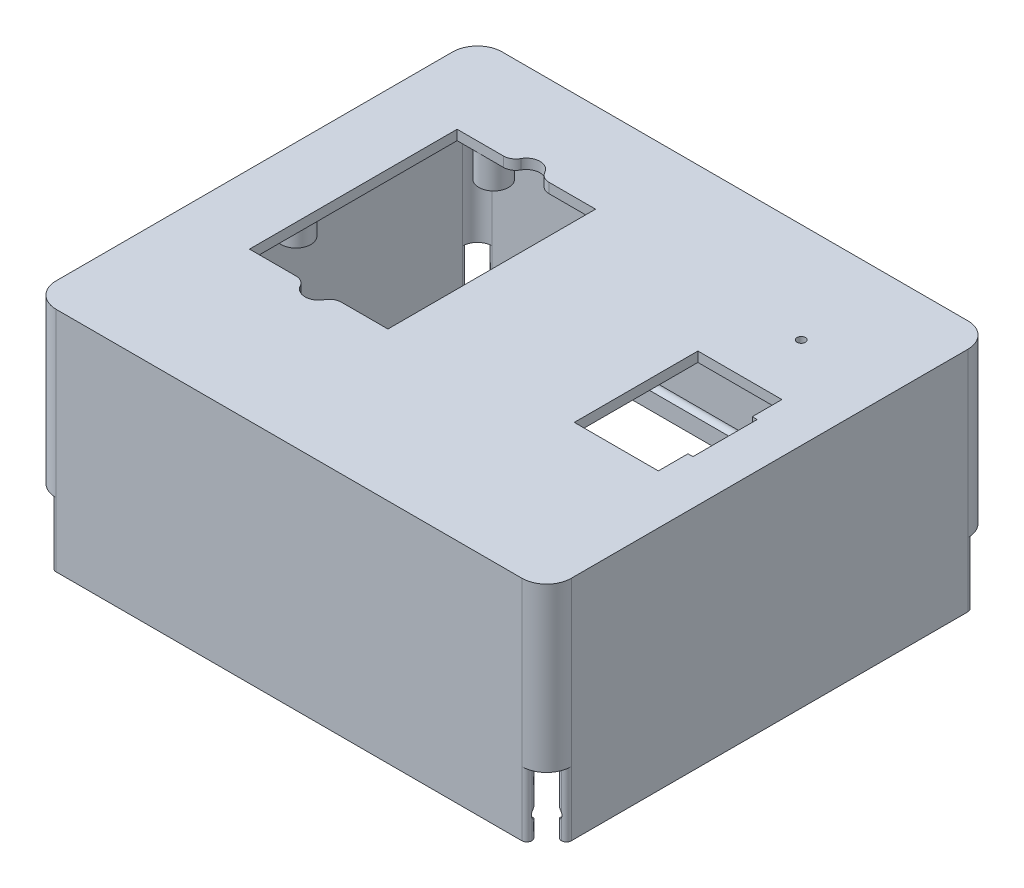
from build123d import *

# Parameters (mm, degrees)
ESQUISSE1_W                   = 104.2
ESQUISSE1_H                   = 90.2
BOSS_EXTRU_1_DEPTH            = 2
ESQUISSE2_W                   = 104.2
ESQUISSE2_H                   = 90.2
ESQUISSE2_W_2                 = 100.2
ESQUISSE2_H_2                 = 86.2
BOSS_EXTRU_2_DEPTH            = 44
ENL_V_MAT_EXTRU_1_DEPTH       = 13
SYM_TRIE2_COPY_1_DEPTH        = 13
CONG_3_R                      = 1
CONG_1_R                      = 5
ENL_V_MAT_EXTRU_2_DEPTH       = 82.758302331
ENL_V_MAT_EXTRU_3_DEPTH       = 82.758302438
ESQUISSE15_W                  = 100.6
ESQUISSE15_H                  = 86.6
ENL_V_MAT_EXTRU_10_DEPTH      = 4.5
ENL_V_MAT_EXTRU_12_REACH      = 83.758
ESQUISSE17_W                  = 28
ESQUISSE17_H                  = 42
ESQUISSE19_R                  = 3
BOSS_EXTRU_5_DEPTH            = 6.2
ESQUISSE20_R                  = 0.85
ENL_V_MAT_EXTRU_13_DEPTH      = 5.8
ENL_V_MAT_EXTRU_16_REACH      = 84.852
ESQUISSE23_W                  = 17
ESQUISSE23_H                  = 25
ENL_V_MAT_EXTRU_17_REACH      = 83.758
ESQUISSE24_R                  = 0.85
ENL_V_MAT_EXTRU_18_REACH      = 84.852
ESQUISSE25_W                  = 1
ESQUISSE25_H                  = 13
ESQUISSE26_W                  = 1.8
ESQUISSE26_H                  = 5.5
ESQUISSE26_W_2                = 24
ESQUISSE26_H_2                = 2
ESQUISSE26_W_3                = 1
BOSS_EXTRU_6_DEPTH            = 2.1
ESQUISSE27_W                  = 5.5
ESQUISSE27_H                  = 7.5
BOSS_EXTRU_7_DEPTH            = 1.5
ENL_V_MAT_EXTRU_20_DEPTH      = 82.758302501
ENL_V_MAT_EXTRU_20_DEPTH_BACK = 82.758302501
ESQUISSE29_R                  = 2.75
CONG_4_R                      = 2.5
CONG_5_R                      = 3


with BuildPart() as part:
    # Esquisse1 → Boss.-Extru.1 (new body)
    with BuildSketch(Plane(origin=(0, 0, 0), x_dir=(1, 0, 0), z_dir=(0, 1, 0))):
        Rectangle(ESQUISSE1_W, ESQUISSE1_H)
    extrude(amount=BOSS_EXTRU_1_DEPTH)

    # Esquisse2 → Boss.-Extru.2 (add)
    with BuildSketch(Plane.XZ):
        Rectangle(ESQUISSE2_W, ESQUISSE2_H)
        Rectangle(ESQUISSE2_W_2, ESQUISSE2_H_2, mode=Mode.SUBTRACT)
    extrude(amount=BOSS_EXTRU_2_DEPTH)

    # Esquisse3 → Enlèv. mat.-Extru.1 (cut)
    with BuildSketch(Plane.XZ.offset(44)):
        Polygon((-50.1, 41.1), (-50.1, 43.1), (-48.1, 43.1), (-48.1, 45.1), (-52.1, 45.1), (-52.1, 41.1), align=None)
    enl_v_mat_extru_1 = extrude(amount=-ENL_V_MAT_EXTRU_1_DEPTH, mode=Mode.SUBTRACT)

    # Symétrie1: Enlèv. mat.-Extru.1 across plane
    add(enl_v_mat_extru_1.mirror(Plane.XY), mode=Mode.SUBTRACT)

    # Symétrie2: Enlèv. mat.-Extru.1 across plane
    add(enl_v_mat_extru_1.mirror(Plane(origin=(0, 0, 0), x_dir=(0, 0, 1), z_dir=(1, 0, 0))), mode=Mode.SUBTRACT)

    # Symétrie2 copy 1 sketch → Symétrie2 copy 1 (cut)
    with BuildSketch(Plane(origin=(0, -44, 0), x_dir=(-1, 0, 0), z_dir=(0, -1, 0))):
        Polygon((-50.1, 41.1), (-50.1, 43.1), (-48.1, 43.1), (-48.1, 45.1), (-52.1, 45.1), (-52.1, 41.1), align=None)
    extrude(amount=-SYM_TRIE2_COPY_1_DEPTH, mode=Mode.SUBTRACT)

    # Congé3
    cong_3_edges = [part.edges().sort_by_distance(p)[0] for p in [
        (-48.1, -37.5, 45.1),
        (-48.1, -37.5, 43.1),
        (-50.1, -37.5, 41.1),
        (-52.1, -37.5, 41.1),
        (48.1, -37.5, 45.1),
        (48.1, -37.5, 43.1),
        (52.1, -37.5, 41.1),
        (50.1, -37.5, 41.1),
        (52.1, -37.5, -41.1),
        (50.1, -37.5, -41.1),
        (48.1, -37.5, -43.1),
        (48.1, -37.5, -45.1),
        (-48.1, -37.5, -45.1),
        (-48.1, -37.5, -43.1),
        (-50.1, -37.5, -41.1),
        (-52.1, -37.5, -41.1),
    ]]
    fillet(cong_3_edges, radius=CONG_3_R - 0.0001)  # a hair under: the kernel refuses the full size

    # Congé1
    cong_1_edges = [part.edges().sort_by_distance(p)[0] for p in [
        (52.1, -14.5, 45.1),
        (52.1, -14.5, -45.1),
        (-52.1, -14.5, -45.1),
        (-52.1, -14.5, 45.1),
    ]]
    fillet(cong_1_edges, radius=CONG_1_R)

    # Esquisse4 → Enlèv. mat.-Extru.2 (cut, symmetric)
    with BuildSketch(Plane(origin=(0, 0, 0), x_dir=(0, 0, -1), z_dir=(1, 0, 0))):
        with BuildLine():
            Line((-43.1, -38.4), (-43.1, -40.6))
            ThreePointArc((-43.1, -40.6), (-44.2, -39.5), (-43.1, -38.4))
        make_face()
    enl_v_mat_extru_2 = extrude(amount=ENL_V_MAT_EXTRU_2_DEPTH, both=True, mode=Mode.SUBTRACT)

    # Symétrie4: Enlèv. mat.-Extru.2 across plane
    add(enl_v_mat_extru_2.mirror(Plane.XY), mode=Mode.SUBTRACT)

    # Esquisse5 → Enlèv. mat.-Extru.3 (cut, symmetric)
    with BuildSketch(Plane.XY):
        with BuildLine():
            Line((-50.1, -38.4), (-50.1, -40.6))
            ThreePointArc((-50.1, -40.6), (-51.2, -39.5), (-50.1, -38.4))
        make_face()
    enl_v_mat_extru_3 = extrude(amount=ENL_V_MAT_EXTRU_3_DEPTH, both=True, mode=Mode.SUBTRACT)

    # Symétrie5: Enlèv. mat.-Extru.3 across plane
    add(enl_v_mat_extru_3.mirror(Plane(origin=(0, 0, 0), x_dir=(0, 0, 1), z_dir=(1, 0, 0))), mode=Mode.SUBTRACT)

    # Esquisse15 → Enlèv. mat.-Extru.10 (cut)
    with BuildSketch(Plane.XZ.offset(44)):
        Rectangle(ESQUISSE15_W, ESQUISSE15_H)
    extrude(amount=-ENL_V_MAT_EXTRU_10_DEPTH, mode=Mode.SUBTRACT)

    # Esquisse17 → Enlèv. mat.-Extru.12 (cut, up to next)
    with BuildSketch(Plane.XZ, mode=Mode.PRIVATE) as enl_v_mat_extru_12_sk1:
        with Locations((-24.1, -6)):
            Rectangle(ESQUISSE17_W, ESQUISSE17_H)
    enl_v_mat_extru_12_tool1 = extrude(enl_v_mat_extru_12_sk1.sketch, amount=-ENL_V_MAT_EXTRU_12_REACH, mode=Mode.PRIVATE) & part.part
    add(enl_v_mat_extru_12_tool1.solids().sort_by_distance((-24.1, 0, -6))[0], mode=Mode.SUBTRACT)

    # Esquisse19 → Boss.-Extru.5 (add)
    with BuildSketch(Plane.XZ):
        with Locations(Location((-33.9, 29.8, 0), (0, 0, 90))):
            Circle(ESQUISSE19_R)
        with Locations(Location((-33.9, -30.2, 0), (0, 0, 90))):
            Circle(ESQUISSE19_R)
        with Locations(Location((-3.9, 19.8, 0), (0, 0, 90))):
            Circle(ESQUISSE19_R)
        with Locations(Location((-3.9, -20.2, 0), (0, 0, 90))):
            Circle(ESQUISSE19_R)
        with Locations(Location((-43.9, -0.2, 0), (0, 0, 90))):
            Circle(ESQUISSE19_R)
    extrude(amount=BOSS_EXTRU_5_DEPTH)

    # Esquisse20 → Enlèv. mat.-Extru.13 (cut)
    with BuildSketch(Plane.XZ.offset(6.2)):
        with Locations(Location((-33.9, 29.8, 0), (0, 0, 270))):
            Circle(ESQUISSE20_R)
        with Locations(Location((-3.9, 19.8, 0), (0, 0, 270))):
            Circle(ESQUISSE20_R)
        with Locations(Location((-3.9, -20.2, 0), (0, 0, 270))):
            Circle(ESQUISSE20_R)
        with Locations(Location((-33.9, -30.2, 0), (0, 0, 270))):
            Circle(ESQUISSE20_R)
        with Locations(Location((-43.9, -0.2, 0), (0, 0, 270))):
            Circle(ESQUISSE20_R)
    extrude(amount=-ENL_V_MAT_EXTRU_13_DEPTH, mode=Mode.SUBTRACT)

    # Esquisse23 → Enlèv. mat.-Extru.16 (cut, up to next)
    with BuildSketch(Plane(origin=(0, 2, 0), x_dir=(1, 0, 0), z_dir=(0, 1, 0)), mode=Mode.PRIVATE) as enl_v_mat_extru_16_sk1:
        with Locations((33.6, 0)):
            Rectangle(ESQUISSE23_W, ESQUISSE23_H)
    enl_v_mat_extru_16_tool1 = extrude(enl_v_mat_extru_16_sk1.sketch, amount=-ENL_V_MAT_EXTRU_16_REACH, mode=Mode.PRIVATE) & part.part
    add(enl_v_mat_extru_16_tool1.solids().sort_by_distance((33.6, 2, 0))[0], mode=Mode.SUBTRACT)

    # Esquisse24 → Enlèv. mat.-Extru.17 (cut, up to next)
    with BuildSketch(Plane.XZ, mode=Mode.PRIVATE) as enl_v_mat_extru_17_sk1:
        with Locations(Location((33.6, -24.9, 0), (0, 0, 270))):
            Circle(ESQUISSE24_R)
    enl_v_mat_extru_17_tool1 = extrude(enl_v_mat_extru_17_sk1.sketch, amount=-ENL_V_MAT_EXTRU_17_REACH, mode=Mode.PRIVATE) & part.part
    add(enl_v_mat_extru_17_tool1.solids().sort_by_distance((33.6, 0, -24.9))[0], mode=Mode.SUBTRACT)

    # Esquisse25 → Enlèv. mat.-Extru.18 (cut, up to next)
    with BuildSketch(Plane(origin=(0, 2, 0), x_dir=(1, 0, 0), z_dir=(0, 1, 0)), mode=Mode.PRIVATE) as enl_v_mat_extru_18_sk1:
        with Locations((42.6, 0)):
            Rectangle(ESQUISSE25_W, ESQUISSE25_H)
    enl_v_mat_extru_18_tool1 = extrude(enl_v_mat_extru_18_sk1.sketch, amount=-ENL_V_MAT_EXTRU_18_REACH, mode=Mode.PRIVATE) & part.part
    add(enl_v_mat_extru_18_tool1.solids().sort_by_distance((42.6, 2, 0))[0], mode=Mode.SUBTRACT)

    # Esquisse26 → Boss.-Extru.6 (add)
    with BuildSketch(Plane.XZ):
        with Locations((22.5, 13.25)):
            Rectangle(ESQUISSE26_W, ESQUISSE26_H)
        with Locations((33.6, 17)):
            Rectangle(ESQUISSE26_W_2, ESQUISSE26_H_2)
        with Locations((45.1, 13.25)):
            Rectangle(ESQUISSE26_W_3, ESQUISSE26_H)
    extrude(amount=BOSS_EXTRU_6_DEPTH)

    # Esquisse27 → Boss.-Extru.7 (add)
    with BuildSketch(Plane.XZ.offset(2.1)):
        with Locations((24.35, 14.25)):
            Rectangle(ESQUISSE27_W, ESQUISSE27_H)
        with Locations((42.85, 14.25)):
            Rectangle(ESQUISSE27_W, ESQUISSE27_H)
    extrude(amount=BOSS_EXTRU_7_DEPTH)

    # Esquisse29 → Enlèv. mat.-Extru.20 (cut, two sides: drawn at the far end of the back side and taken through both)
    with BuildSketch(Plane.XZ.offset(-ENL_V_MAT_EXTRU_20_DEPTH_BACK)):
        with Locations((-24.1, 15)):
            Circle(ESQUISSE29_R)
        with Locations((-24.1, -27)):
            Circle(ESQUISSE29_R)
    extrude(amount=ENL_V_MAT_EXTRU_20_DEPTH + ENL_V_MAT_EXTRU_20_DEPTH_BACK, mode=Mode.SUBTRACT)

    # Congé4
    cong_4_edges = [part.edges().sort_by_distance(p)[0] for p in [
        (-21.35, 1, 15),
        (-26.85, 1, 15),
        (-26.85, 1, -27),
        (-21.35, 1, -27),
    ]]
    fillet(cong_4_edges, radius=CONG_4_R)

    # Congé5
    cong_5_edges = [part.edges().sort_by_distance(p)[0] for p in [
        (-50.1, -15.5, -43.1),
        (50.1, -15.5, -43.1),
        (50.1, -15.5, 43.1),
        (-50.1, -15.5, 43.1),
    ]]
    fillet(cong_5_edges, radius=CONG_5_R - 0.0001)  # a hair under: the kernel refuses the full size


solid = part.part
